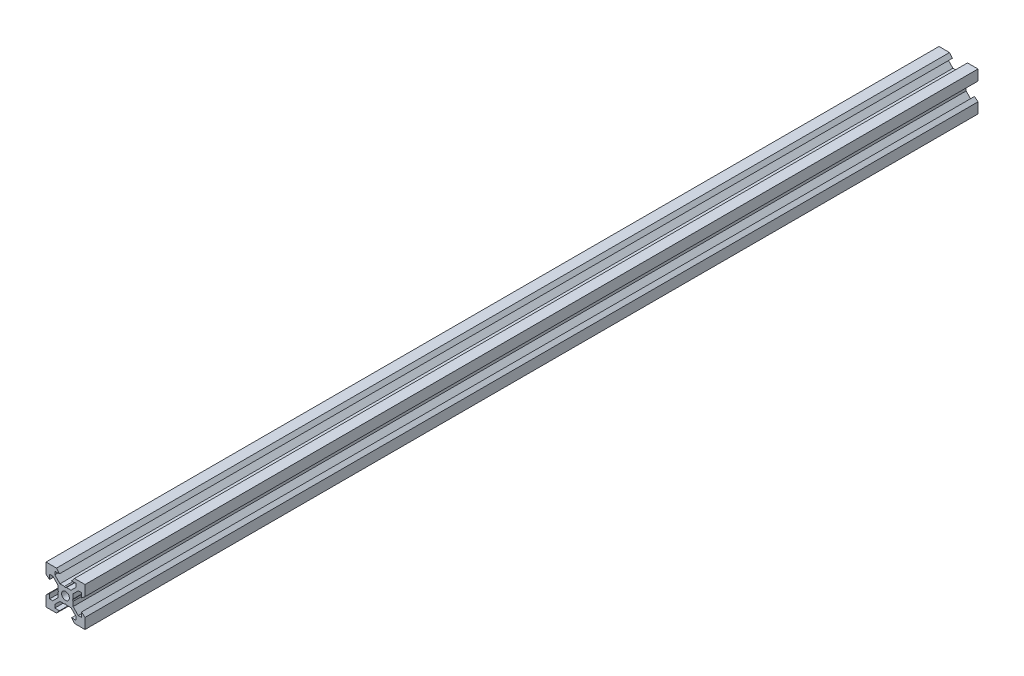
from build123d import *

# Parameters (mm, degrees)
SKETCH1_R           = 2
BOSS_EXTRUDE1_DEPTH = 229


with BuildPart() as part:
    # Sketch1 → Boss-Extrude1 (new, symmetric)
    with BuildSketch(Plane.XY):
        Polygon((10, 4.610379336), (10, 10), (4.610379336, 10), (3.1, 8.2), (5.5, 8.2), (5.5, 6.560660172), (2.839339828, 3.9), (0.519615242, 3.9), (0, 3.6), (-0.519615242, 3.9), (-2.839339828, 3.9), (-5.5, 6.560660172), (-5.5, 8.2), (-3.1, 8.2), (-4.610379336, 10), (-10, 10), (-10, 4.610379336), (-8.2, 3.1), (-8.2, 5.5), (-6.560660172, 5.5), (-3.9, 2.839339828), (-3.9, 0.519615242), (-3.6, 0), (-3.9, -0.519615242), (-3.9, -2.839339828), (-6.560660172, -5.5), (-8.2, -5.5), (-8.2, -3.1), (-10, -4.610379336), (-10, -10), (-4.610379336, -10), (-3.1, -8.2), (-5.5, -8.2), (-5.5, -6.560660172), (-2.839339828, -3.9), (-0.519615242, -3.9), (0, -3.6), (0.519615242, -3.9), (2.839339828, -3.9), (5.5, -6.560660172), (5.5, -8.2), (3.1, -8.2), (4.610379336, -10), (10, -10), (10, -4.610379336), (8.2, -3.1), (8.2, -5.5), (6.560660172, -5.5), (3.9, -2.839339828), (3.9, -0.519615242), (3.6, 0), (3.9, 0.519615242), (3.9, 2.839339828), (6.560660172, 5.5), (8.2, 5.5), (8.2, 3.1), align=None)
        Circle(SKETCH1_R, mode=Mode.SUBTRACT)
    extrude(amount=BOSS_EXTRUDE1_DEPTH, both=True)


solid = part.part
